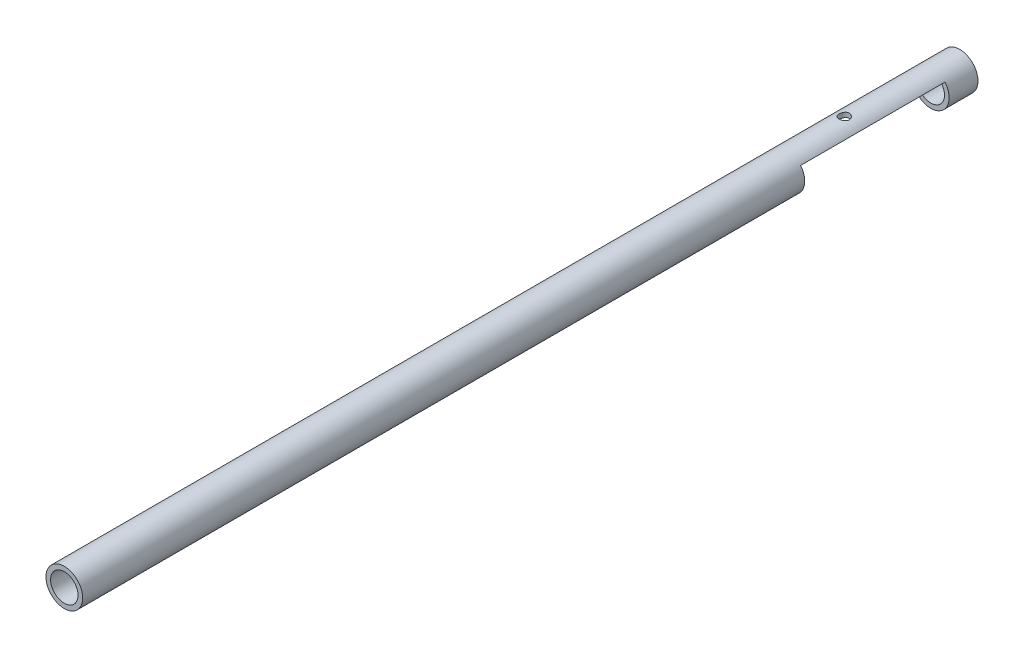
from build123d import *

# Parameters (mm, degrees)
SKETCH1_R               = 3.175
SKETCH1_R_2             = 2.375
BOSS_EXTRUDE1_DEPTH     = 155
CUT_EXTRUDE1_DEPTH      = 2
CUT_EXTRUDE1_DEPTH_BACK = 5
SKETCH2_W               = 13.029993618
SKETCH2_H               = 25
SKETCH3_R               = 0.889
F_2_56_HOLE_DEPTH       = 3


with BuildPart() as part:
    # Sketch1 → Boss-Extrude1 (new body)
    with BuildSketch(Plane.XY):
        Circle(SKETCH1_R)
        Circle(SKETCH1_R_2, mode=Mode.SUBTRACT)
    extrude(amount=BOSS_EXTRUDE1_DEPTH)

    # Sketch2 → Cut-Extrude1 (cut, two sides: drawn at the far end of the back side and taken through both)
    with BuildSketch(Plane(origin=(0, 0, 0), x_dir=(1, 0, 0), z_dir=(0, 1, 0)).offset(-CUT_EXTRUDE1_DEPTH_BACK)):
        with Locations((0.986854582, -17.5)):
            Rectangle(SKETCH2_W, SKETCH2_H)
    extrude(amount=CUT_EXTRUDE1_DEPTH + CUT_EXTRUDE1_DEPTH_BACK, mode=Mode.SUBTRACT)

    # Sketch3 → 2-56 hole (cut)
    with BuildSketch(Plane(origin=(0, 2, 0), x_dir=(-1, 0, 0), z_dir=(0, -1, 0))):
        with Locations((0, -20)):
            Circle(SKETCH3_R)
    extrude(amount=-F_2_56_HOLE_DEPTH, mode=Mode.SUBTRACT)


solid = part.part
